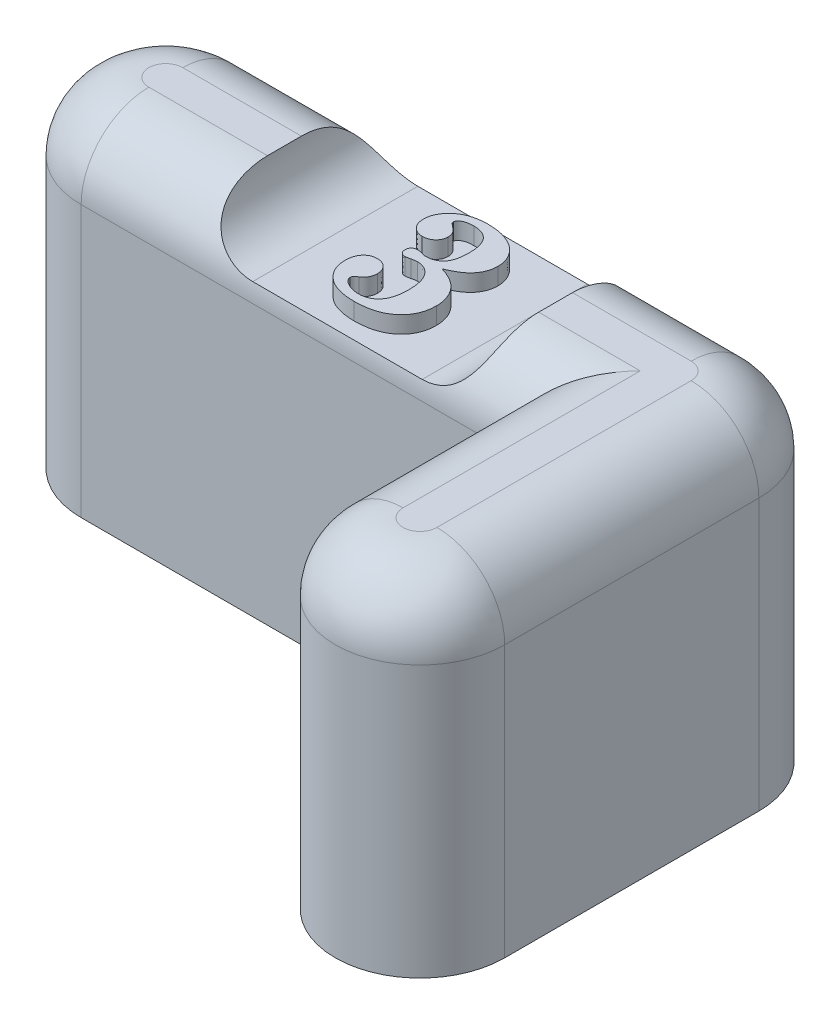
from build123d import *

# Parameters (mm, degrees)
BOSS_EXTRUDE1_DEPTH     = 20
FILLET1_R               = 4
SKETCH2_R               = 2.75
CUT_EXTRUDE1_DEPTH      = 1.5
LPATTERN1_COUNT         = 2
LPATTERN1_PITCH         = 30
CUT_EXTRUDE2_DEPTH      = 35.641016151
CUT_EXTRUDE2_DEPTH_BACK = 35.641016151
WRAP1_DEPTH             = 1


# Read off the part's stored shape, not the designer's step: Wrap1
with BuildPart() as part:
    # Sketch1 → Boss-Extrude1 (new body)
    with BuildSketch(Plane(origin=(0, 0, 0), x_dir=(1, 0, 0), z_dir=(0, 1, 0))):
        with BuildLine():
            Line((-15, -5), (10, -5))
            Line((10, -5), (10, -15))
            ThreePointArc((10, -15), (15, -20), (20, -15))
            Line((20, -15), (20, 0))
            ThreePointArc((20, 0), (18.535533906, 3.535533906), (15, 5))
            Line((15, 5), (-15, 5))
            ThreePointArc((-15, 5), (-20, 0), (-15, -5))
        make_face()
    extrude(amount=BOSS_EXTRUDE1_DEPTH)

    # Fillet1
    fillet1_edges = [part.edges().sort_by_distance(p)[0] for p in [
        (15, 20, 20),
        (20, 20, 7.5),
        (18.535533906, 20, -3.535533906),
        (0, 20, -5),
        (-20, 20, 0),
        (-2.5, 20, 5),
        (10, 20, 10),
    ]]
    fillet(fillet1_edges, radius=FILLET1_R)

    # Sketch2 → Cut-Extrude1 (cut)
    with BuildSketch(Plane.XZ):
        with Locations(Location((-15, 0, 0), (0, 0, 270))):
            Circle(SKETCH2_R)
    cut_extrude1 = extrude(amount=-CUT_EXTRUDE1_DEPTH, mode=Mode.SUBTRACT)

    # LPattern1: Cut-Extrude1 ×2
    with Locations(*[(i * LPATTERN1_PITCH, 0, 0) for i in range(1, LPATTERN1_COUNT)]):
        add(cut_extrude1, mode=Mode.SUBTRACT)

    # Sketch3 → Cut-Extrude2 (cut, two sides: drawn at the far end of the back side and taken through both)
    with BuildSketch(Plane.XY.offset(-CUT_EXTRUDE2_DEPTH_BACK)):
        with BuildLine():
            Line((5, 17), (-5, 17))
            ThreePointArc((-5, 17), (-8, 20), (-5, 23))
            Line((-5, 23), (5, 23))
            ThreePointArc((5, 23), (8, 20), (5, 17))
        make_face()
    extrude(amount=CUT_EXTRUDE2_DEPTH + CUT_EXTRUDE2_DEPTH_BACK, mode=Mode.SUBTRACT)

    # Wrap1 outline → Wrap1 (add)
    with BuildSketch(Plane(origin=(0, 17, 0), x_dir=(1, 0, 0), z_dir=(0, 1, 0))):
        with BuildLine():
            add(Edge.make_bspline(
                [(2.662376713, -1.699791325), (2.660125967, -1.779482769), (2.65571143, -1.935786862), (2.623823884, -2.164939199), (2.567439843, -2.381857511), (2.48930945, -2.587195786), (2.393021108, -2.782595069), (2.268058307, -2.962660951), (2.125842046, -3.133794123), (1.960369934, -3.290331419), (1.775600728, -3.431563117), (1.572810734, -3.555559773), (1.351880541, -3.659846918), (1.113465537, -3.744683656), (0.857557845, -3.810303045), (0.584061654, -3.855597831), (0.293378739, -3.885499134), (0.093544715, -3.888800662), (-0.009097646, -3.890496453)],
                knots=[0, 0, 0, 0, 0.061354375, 0.120338389, 0.177702509, 0.233546768, 0.289283374, 0.3449562, 0.401886605, 0.460365064, 0.51992708, 0.580664812, 0.643036542, 0.707697668, 0.775236972, 0.846171603, 0.920987881, 1, 1, 1, 1], degree=3))
            add(Edge.make_bspline(
                [(0.925197226, 0.365913803), (0.995553059, 0.345675271), (1.133064342, 0.306118828), (1.328590384, 0.229053958), (1.511983092, 0.146897982), (1.681218971, 0.053390502), (1.836707441, -0.049506633), (1.981010533, -0.160079063), (2.110384453, -0.281874972), (2.226357436, -0.412508439), (2.329162362, -0.550079325), (2.417543605, -0.695281914), (2.493077526, -0.84645973), (2.556412058, -1.004252954), (2.604078485, -1.169172198), (2.63748024, -1.340819046), (2.65919655, -1.518141993), (2.66130945, -1.638829779), (2.662376713, -1.699791325)],
                knots=[0, 0, 0, 0, 0.075025699, 0.146638589, 0.215271416, 0.280976256, 0.344630791, 0.406315274, 0.467154943, 0.526516949, 0.585236113, 0.643010064, 0.700575913, 0.758349864, 0.817112444, 0.876302356, 0.937518121, 1, 1, 1, 1], degree=3))
            add(Edge.make_bspline(
                [(2.457248508, 2.135144573), (2.452961752, 2.044459213), (2.444499701, 1.865446436), (2.375898021, 1.604306447), (2.263951607, 1.358636726), (2.135140454, 1.167487179), (2.008194454, 1.025122645), (1.899081128, 0.917442417), (1.771410076, 0.818401737), (1.631515761, 0.719277698), (1.475928172, 0.62607575), (1.306468758, 0.533503741), (1.121675464, 0.446215438), (0.991692806, 0.393090878), (0.925197226, 0.365913803)],
                knots=[0, 0, 0, 0, 0.108587554, 0.214351684, 0.321241858, 0.430999345, 0.489069076, 0.549749196, 0.614451706, 0.682490285, 0.755190336, 0.831693801, 0.913899143, 1, 1, 1, 1], degree=3))
            add(Edge.make_bspline(
                [(0.021351072, 4.006939444), (0.143832762, 4.003919378), (0.381180053, 3.998067037), (0.723980775, 3.951499724), (1.041081432, 3.87383755), (1.329738693, 3.762564169), (1.590237329, 3.627462638), (1.818779553, 3.467477553), (2.015528394, 3.286137683), (2.174310612, 3.080606082), (2.299973438, 2.860881597), (2.3907075, 2.628867275), (2.447898099, 2.385773958), (2.454107893, 2.219325952), (2.457248508, 2.135144573)],
                knots=[0, 0, 0, 0, 0.10695053, 0.207250721, 0.301516556, 0.391461648, 0.476821793, 0.557207781, 0.634455968, 0.709589712, 0.783146573, 0.854802433, 0.926566069, 1, 1, 1, 1], degree=3))
            add(Edge.make_bspline(
                [(-1.699802774, 3.401170214), (-1.649259185, 3.450219378), (-1.548011852, 3.548473127), (-1.371505963, 3.669789233), (-1.180172052, 3.77407179), (-0.972748068, 3.861343074), (-0.747857761, 3.926753731), (-0.506292911, 3.972177467), (-0.248081921, 4.001919629), (-0.070081208, 4.005235966), (0.021351072, 4.006939444)],
                knots=[0, 0, 0, 0, 0.112520394, 0.225397328, 0.341295234, 0.46082693, 0.584695833, 0.715280351, 0.853750211, 1, 1, 1, 1], degree=3))
            add(Edge.make_bspline(
                [(-2.158136107, 2.359503547), (-2.157232903, 2.407157081), (-2.155436334, 2.50194498), (-2.130853415, 2.641730221), (-2.097196926, 2.778899734), (-2.04406182, 2.910636295), (-1.980215668, 3.039895837), (-1.90073978, 3.165073531), (-1.808238426, 3.287566912), (-1.736376465, 3.362853553), (-1.699802774, 3.401170214)],
                knots=[0, 0, 0, 0, 0.122161592, 0.242992273, 0.363386459, 0.4840848, 0.606730262, 0.733038715, 0.864131742, 1, 1, 1, 1], degree=3))
            add(Edge.make_bspline(
                [(-1.311982261, 1.44283688), (-1.369501429, 1.445751305), (-1.482387801, 1.451471118), (-1.643470384, 1.501507763), (-1.790511388, 1.582191204), (-1.919374713, 1.694184751), (-2.024891054, 1.832476836), (-2.104075288, 1.990776992), (-2.148986666, 2.169588619), (-2.155010138, 2.29461781), (-2.158136107, 2.359503547)],
                knots=[0, 0, 0, 0, 0.123503177, 0.242385729, 0.359144057, 0.482175805, 0.606759678, 0.731136659, 0.860469416, 1, 1, 1, 1], degree=3))
            add(Edge.make_bspline(
                [(-0.517110466, 2.178413803), (-0.519836352, 2.127381076), (-0.525128696, 2.028300325), (-0.567977871, 1.885848658), (-0.64254429, 1.758979104), (-0.741656084, 1.647474514), (-0.861515602, 1.555368787), (-0.999642968, 1.491286564), (-1.150840338, 1.44895786), (-1.257195244, 1.444917966), (-1.311982261, 1.44283688)],
                knots=[0, 0, 0, 0, 0.126444231, 0.245493237, 0.364814777, 0.488720188, 0.613543272, 0.736823611, 0.86442892, 1, 1, 1, 1], degree=3))
            add(Edge.make_bspline(
                [(-0.946597646, 2.864311239), (-0.905960321, 2.832939328), (-0.830597941, 2.77475976), (-0.733821029, 2.683917856), (-0.657017044, 2.601588192), (-0.60162832, 2.52205442), (-0.563211883, 2.44280606), (-0.535640752, 2.360546702), (-0.519330966, 2.271473482), (-0.517864133, 2.209999459), (-0.517110466, 2.178413803)],
                knots=[0, 0, 0, 0, 0.182070801, 0.337652372, 0.470523462, 0.580943793, 0.680135151, 0.782042625, 0.888012428, 1, 1, 1, 1], degree=3))
            add(Edge.make_bspline(
                [(-1.132495082, 3.112708675), (-1.131740273, 3.092193559), (-1.130357664, 3.05461533), (-1.11072767, 3.009170276), (-1.081800156, 2.978015512), (-1.048357094, 2.946779478), (-1.002701632, 2.907313375), (-0.966531823, 2.879590229), (-0.946597646, 2.864311239)],
                knots=[0, 0, 0, 0, 0.188481556, 0.345248003, 0.443161045, 0.579238055, 0.768106505, 1, 1, 1, 1], degree=3))
            add(Edge.make_bspline(
                [(-0.310379697, 3.494118932), (-0.373477716, 3.492613471), (-0.492109431, 3.489783028), (-0.65851725, 3.468353613), (-0.801089914, 3.430567959), (-0.919320443, 3.378584446), (-1.010024239, 3.315572929), (-1.079512146, 3.253265448), (-1.124021254, 3.18478104), (-1.129799153, 3.135638333), (-1.132495082, 3.112708675)],
                knots=[0, 0, 0, 0, 0.19340588, 0.363625855, 0.512994624, 0.644183797, 0.757282422, 0.849945944, 0.929985784, 1, 1, 1, 1], degree=3))
            add(Edge.make_bspline(
                [(0.91878697, 1.992516367), (0.918139033, 2.056132458), (0.916884464, 2.179309322), (0.899477704, 2.357333008), (0.877062578, 2.522602287), (0.842188903, 2.674107694), (0.795141637, 2.810399443), (0.74125858, 2.934331193), (0.674925209, 3.043746653), (0.599473447, 3.141046499), (0.513485893, 3.224635076), (0.420054196, 3.297382402), (0.318338203, 3.358631271), (0.208601464, 3.40841456), (0.090422968, 3.44737391), (-0.036035362, 3.47321334), (-0.17036917, 3.492577034), (-0.262760384, 3.493594513), (-0.310379697, 3.494118932)],
                knots=[0, 0, 0, 0, 0.085873572, 0.166272986, 0.241360724, 0.311004539, 0.375793903, 0.435856468, 0.493138333, 0.548120936, 0.601684393, 0.654642041, 0.707717483, 0.761629576, 0.81706464, 0.875359625, 0.935759162, 1, 1, 1, 1], degree=3))
            add(Edge.make_bspline(
                [(0.627120303, 0.862708675), (0.650981894, 0.892540026), (0.700129897, 0.953984015), (0.758791518, 1.061527885), (0.807926702, 1.182784715), (0.850189195, 1.317077731), (0.878871112, 1.466745808), (0.904112809, 1.629051612), (0.915644117, 1.806457057), (0.917713047, 1.928939315), (0.91878697, 1.992516367)],
                knots=[0, 0, 0, 0, 0.096159815, 0.198061519, 0.307357594, 0.425781566, 0.552299199, 0.691147288, 0.839683351, 1, 1, 1, 1], degree=3))
            add(Edge.make_bspline(
                [(-0.194995082, 0.519759957), (-0.152203666, 0.52049355), (-0.0689687, 0.521920485), (0.052349804, 0.53850406), (0.16642789, 0.565156283), (0.273026918, 0.604333511), (0.372841334, 0.652667045), (0.467103821, 0.710011308), (0.552092463, 0.781019519), (0.602059568, 0.835422933), (0.627120303, 0.862708675)],
                knots=[0, 0, 0, 0, 0.139400172, 0.271151778, 0.398277016, 0.520563852, 0.640497354, 0.759364307, 0.879310449, 1, 1, 1, 1], degree=3))
            add(Edge.make_bspline(
                [(-0.497879697, 0.579054829), (-0.441710176, 0.561644036), (-0.342768132, 0.530975099), (-0.239596186, 0.52314493), (-0.194995082, 0.519759957)],
                knots=[0, 0, 0, 0, 0.567701235, 1, 1, 1, 1], degree=3))
            add(Edge.make_bspline(
                [(-0.730251492, 0.62232406), (-0.696980459, 0.619443692), (-0.618183576, 0.612622021), (-0.541933879, 0.591346828), (-0.497879697, 0.579054829)],
                knots=[0, 0, 0, 0, 0.422237936, 1, 1, 1, 1], degree=3))
            add(Edge.make_bspline(
                [(-1.132495082, 0.253734316), (-1.131442549, 0.282710686), (-1.12944712, 0.337645159), (-1.109977263, 0.41379738), (-1.079399787, 0.478965944), (-1.034690658, 0.532103224), (-0.976245129, 0.572346494), (-0.906133339, 0.604235885), (-0.821557848, 0.617971327), (-0.761785922, 0.620820758), (-0.730251492, 0.62232406)],
                knots=[0, 0, 0, 0, 0.138834815, 0.263208175, 0.374439269, 0.481790582, 0.592071981, 0.712606806, 0.848377303, 1, 1, 1, 1], degree=3))
            add(Edge.make_bspline(
                [(-0.794354056, -0.095624658), (-0.818977599, -0.094142072), (-0.866625096, -0.091273211), (-0.934907549, -0.076453403), (-0.993948809, -0.046196883), (-1.045058452, -0.00633302), (-1.082958329, 0.046692131), (-1.113403831, 0.106783222), (-1.128359815, 0.177735818), (-1.131068135, 0.227509688), (-1.132495082, 0.253734316)],
                knots=[0, 0, 0, 0, 0.134273141, 0.259823658, 0.376868709, 0.492678997, 0.608999304, 0.728652424, 0.857033635, 1, 1, 1, 1], degree=3))
            add(Edge.make_bspline(
                [(-0.494674569, -0.047547735), (-0.525584667, -0.054866244), (-0.583426104, -0.06856122), (-0.664908883, -0.082138476), (-0.733702808, -0.09325454), (-0.775625596, -0.094892791), (-0.794354056, -0.095624658)],
                knots=[0, 0, 0, 0, 0.31333056, 0.586329099, 0.81519791, 1, 1, 1, 1], degree=3))
            add(Edge.make_bspline(
                [(-0.167751492, 0.006939444), (-0.190210162, 0.006207634), (-0.238506352, 0.004633916), (-0.31572915, -0.005413995), (-0.40219408, -0.02364394), (-0.462686126, -0.039279557), (-0.494674569, -0.047547735)],
                knots=[0, 0, 0, 0, 0.202759475, 0.436023603, 0.701766965, 1, 1, 1, 1], degree=3))
            add(Edge.make_bspline(
                [(1.021351072, -1.680560556), (1.020594436, -1.611088592), (1.019131333, -1.476751083), (1.00320168, -1.281812091), (0.97541097, -1.101741637), (0.941839683, -0.934308027), (0.892575943, -0.782091763), (0.836586616, -0.641960336), (0.766252266, -0.517511101), (0.688330473, -0.406362009), (0.600317736, -0.309978538), (0.50844132, -0.224427411), (0.409009645, -0.154000232), (0.306191369, -0.09260876), (0.194907308, -0.048725307), (0.078918275, -0.016413659), (-0.042605524, 0.003469717), (-0.125475479, 0.005767323), (-0.167751492, 0.006939444)],
                knots=[0, 0, 0, 0, 0.089659443, 0.173373917, 0.252164698, 0.32478559, 0.393476985, 0.458396676, 0.519206122, 0.577557919, 0.633215921, 0.687389211, 0.739248931, 0.790220988, 0.841564769, 0.893088794, 0.94545937, 1, 1, 1, 1], degree=3))
            add(Edge.make_bspline(
                [(-0.259097646, -3.37767594), (-0.210954855, -3.376484663), (-0.11640908, -3.374145161), (0.021086501, -3.354677066), (0.151415222, -3.32284249), (0.272630421, -3.276166107), (0.386535435, -3.217641103), (0.493403075, -3.147229794), (0.590458033, -3.061257801), (0.68187471, -2.964912402), (0.761741998, -2.852944549), (0.833320736, -2.727940504), (0.888981064, -2.586731612), (0.940819381, -2.434000968), (0.975370103, -2.265344462), (1.00338236, -2.083064352), (1.019055403, -1.886496561), (1.020570706, -1.750564377), (1.021351072, -1.680560556)],
                knots=[0, 0, 0, 0, 0.059792206, 0.117423613, 0.172153936, 0.226142792, 0.27838593, 0.331032237, 0.384664997, 0.439137156, 0.495692256, 0.555129784, 0.617620129, 0.683943919, 0.755285008, 0.831127377, 0.913032156, 1, 1, 1, 1], degree=3))
            add(Edge.make_bspline(
                [(-1.087623287, -3.142099017), (-1.025572622, -3.178338349), (-0.901519518, -3.250788848), (-0.69687502, -3.322878222), (-0.481906707, -3.370304798), (-0.334147235, -3.375193091), (-0.259097646, -3.37767594)],
                knots=[0, 0, 0, 0, 0.24650055, 0.492809516, 0.742389192, 1, 1, 1, 1], degree=3))
            add(Edge.make_bspline(
                [(-1.337623287, -2.78793235), (-1.334336019, -2.820023388), (-1.327584489, -2.885933318), (-1.27540079, -2.979374427), (-1.194353566, -3.066584193), (-1.125048794, -3.115619366), (-1.087623287, -3.142099017)],
                knots=[0, 0, 0, 0, 0.212636247, 0.436721323, 0.695821952, 1, 1, 1, 1], degree=3))
            add(Edge.make_bspline(
                [(-1.106854056, -2.493060556), (-1.131340402, -2.510766622), (-1.175290316, -2.542546787), (-1.235348112, -2.584156557), (-1.274364642, -2.623583015), (-1.31121329, -2.661238809), (-1.334475549, -2.717271556), (-1.336519362, -2.763151328), (-1.337623287, -2.78793235)],
                knots=[0, 0, 0, 0, 0.230116423, 0.41303007, 0.553895719, 0.651787808, 0.811920297, 1, 1, 1, 1], degree=3))
            add(Edge.make_bspline(
                [(-0.722238671, -1.784727222), (-0.723567047, -1.8211138), (-0.726161802, -1.892188758), (-0.743613732, -1.995840854), (-0.774936458, -2.092938887), (-0.816536363, -2.185466951), (-0.871517179, -2.271858032), (-0.937728214, -2.353084068), (-1.017213517, -2.426949735), (-1.076487017, -2.470664551), (-1.106854056, -2.493060556)],
                knots=[0, 0, 0, 0, 0.129765424, 0.253474568, 0.373369941, 0.492719229, 0.614282922, 0.737462889, 0.865496811, 1, 1, 1, 1], degree=3))
            add(Edge.make_bspline(
                [(-1.501084825, -1.018701581), (-1.44637388, -1.021606884), (-1.340208413, -1.027244565), (-1.188276931, -1.067013543), (-1.053417207, -1.138422259), (-0.936941467, -1.234914308), (-0.84027589, -1.350745599), (-0.772484748, -1.484090897), (-0.727970452, -1.62965685), (-0.724186279, -1.73203571), (-0.722238671, -1.784727222)],
                knots=[0, 0, 0, 0, 0.134279191, 0.260566015, 0.381986206, 0.505901784, 0.629817363, 0.749468442, 0.87105847, 1, 1, 1, 1], degree=3))
            add(Edge.make_bspline(
                [(-2.363264312, -2.055560556), (-2.361132515, -1.978877037), (-2.357062545, -1.832474947), (-2.30904512, -1.626202253), (-2.234805557, -1.444309304), (-2.127599539, -1.291921329), (-1.997047063, -1.170835275), (-1.847997846, -1.08125351), (-1.67975529, -1.028343211), (-1.561824386, -1.021979282), (-1.501084825, -1.018701581)],
                knots=[0, 0, 0, 0, 0.151527419, 0.28929203, 0.416768361, 0.538233618, 0.654975674, 0.766880183, 0.879933125, 1, 1, 1, 1], degree=3))
            add(Edge.make_bspline(
                [(-0.009097646, -3.890496453), (-0.099971707, -3.889077213), (-0.276712202, -3.886316941), (-0.534202967, -3.861502844), (-0.776284513, -3.823155341), (-1.001970987, -3.764152887), (-1.212686085, -3.692960119), (-1.408243205, -3.604977635), (-1.586377601, -3.498405994), (-1.748793939, -3.378414134), (-1.892962785, -3.245346848), (-2.01906639, -3.102182821), (-2.12522051, -2.949288039), (-2.212400526, -2.788081598), (-2.280850708, -2.617795004), (-2.328135414, -2.437969512), (-2.358000181, -2.249397562), (-2.361491357, -2.120844708), (-2.363264312, -2.055560556)],
                knots=[0, 0, 0, 0, 0.081203508, 0.157932285, 0.231010373, 0.300029536, 0.366164379, 0.429625425, 0.491284509, 0.551349815, 0.609805188, 0.666309249, 0.721540184, 0.775802975, 0.82979833, 0.885159131, 0.941679328, 1, 1, 1, 1], degree=3))
        make_face()
    extrude(amount=WRAP1_DEPTH)


solid = part.part
